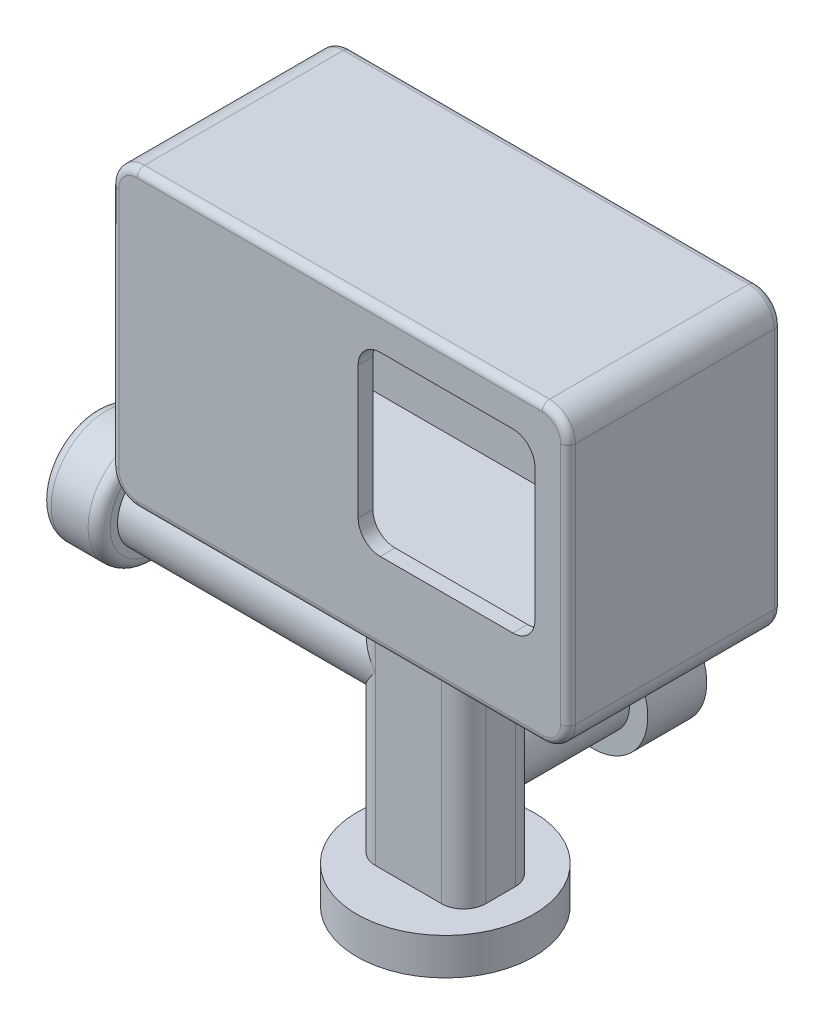
from build123d import *

# Parameters (mm, degrees)
BOSS_EXTRUDE1_DEPTH      = 27
BOSS_EXTRUDE2_START      = 2
BOSS_EXTRUDE2_DEPTH      = 2
SKETCH3_W                = 15
SKETCH3_H                = 10
BOSS_EXTRUDE3_DEPTH      = 40
SKETCH4_R                = 12
BOSS_EXTRUDE4_DEPTH      = 5
FILLET2_R                = 3
BOSS_EXTRUDE5_DEPTH      = 32
BOSS_EXTRUDE5_DEPTH_BACK = 10
SKETCH5_R                = 5
SKETCH6_R                = 7.5
BOSS_EXTRUDE6_DEPTH      = 8
SKETCH7_R                = 5
BOSS_EXTRUDE7_DEPTH      = 5
BOSS_EXTRUDE8_DEPTH      = 1
FILLET3_R                = 1
FILLET4_R                = 1.5
FILLET5_R                = 1
BOSS_EXTRUDE9_DEPTH      = 15
BOSS_EXTRUDE9_DEPTH_BACK = 5
SKETCH9_R                = 5
SKETCH11_R               = 7.5
BOSS_EXTRUDE10_DEPTH     = 8


with BuildPart() as part:
    # Sketch1 → Boss-Extrude1 (new body)
    with BuildSketch(Plane.XY):
        with BuildLine():
            Line((31, 80), (31, 47))
            ThreePointArc((31, 47), (29.974873734, 44.525126266), (27.5, 43.5))
            Line((27.5, 43.5), (-27.5, 43.5))
            ThreePointArc((-27.5, 43.5), (-29.974873734, 44.525126266), (-31, 47))
            Line((-31, 47), (-31, 80))
            ThreePointArc((-31, 80), (-29.974873734, 82.474873734), (-27.5, 83.5))
            Line((-27.5, 83.5), (27.5, 83.5))
            ThreePointArc((27.5, 83.5), (29.974873734, 82.474873734), (31, 80))
        make_face()
        with BuildLine():
            Line((29.5, 80), (29.5, 47))
            ThreePointArc((29.5, 47), (28.914213562, 45.585786438), (27.5, 45))
            Line((27.5, 45), (-27.5, 45))
            ThreePointArc((-27.5, 45), (-28.914213562, 45.585786438), (-29.5, 47))
            Line((-29.5, 47), (-29.5, 80))
            ThreePointArc((-29.5, 80), (-28.914213562, 81.414213562), (-27.5, 82))
            Line((-27.5, 82), (27.5, 82))
            ThreePointArc((27.5, 82), (28.914213562, 81.414213562), (29.5, 80))
        make_face(mode=Mode.SUBTRACT)
    extrude(amount=-BOSS_EXTRUDE1_DEPTH)

    # Sketch2 → Boss-Extrude2 (add)
    with BuildSketch(Plane.XY.offset(BOSS_EXTRUDE2_START)):
        with BuildLine():
            Line((27.5, 83.5), (-27.5, 83.5))
            ThreePointArc((-27.5, 83.5), (-29.974873734, 82.474873734), (-31, 80))
            Line((-31, 80), (-31, 47))
            ThreePointArc((-31, 47), (-29.974873734, 44.525126266), (-27.5, 43.5))
            Line((-27.5, 43.5), (27.5, 43.5))
            ThreePointArc((27.5, 43.5), (29.974873734, 44.525126266), (31, 47))
            Line((31, 47), (31, 80))
            ThreePointArc((31, 80), (29.974873734, 82.474873734), (27.5, 83.5))
        make_face()
        with BuildLine():
            Line((23.5, 78.5), (5.5, 78.5))
            ThreePointArc((5.5, 78.5), (3.378679656, 77.621320344), (2.5, 75.5))
            Line((2.5, 75.5), (2.5, 57.5))
            ThreePointArc((2.5, 57.5), (3.378679656, 55.378679656), (5.5, 54.5))
            Line((5.5, 54.5), (23.5, 54.5))
            ThreePointArc((23.5, 54.5), (25.621320344, 55.378679656), (26.5, 57.5))
            Line((26.5, 57.5), (26.5, 75.5))
            ThreePointArc((26.5, 75.5), (25.621320344, 77.621320344), (23.5, 78.5))
        make_face(mode=Mode.SUBTRACT)
    extrude(amount=-BOSS_EXTRUDE2_DEPTH)

    # Sketch3 → Boss-Extrude3 (add)
    with BuildSketch(Plane.XZ.offset(-43.5)):
        with Locations((0, -12.332332162)):
            Rectangle(SKETCH3_W, SKETCH3_H)
    extrude(amount=BOSS_EXTRUDE3_DEPTH)

    # Sketch4 → Boss-Extrude4 (add)
    with BuildSketch(Plane.XZ.offset(-3.5)):
        with Locations((0, -12.332332162)):
            Circle(SKETCH4_R)
    extrude(amount=-BOSS_EXTRUDE4_DEPTH)

    # Fillet2
    fillet2_edges = [part.edges().sort_by_distance(p)[0] for p in [
        (7.5, 26, -7.332332162),
        (-7.5, 26, -7.332332162),
        (-7.5, 26, -17.332332162),
        (7.5, 26, -17.332332162),
    ]]
    fillet(fillet2_edges, radius=FILLET2_R)

    # Sketch5 → Boss-Extrude5 (add, two sides: drawn at the far end of the back side and taken through both)
    with BuildSketch(Plane.ZY.offset(7.5).offset(-BOSS_EXTRUDE5_DEPTH_BACK)):
        with Locations((-12.332332162, 31.227787974)):
            Circle(SKETCH5_R)
    extrude(amount=BOSS_EXTRUDE5_DEPTH + BOSS_EXTRUDE5_DEPTH_BACK)

    # Sketch6 → Boss-Extrude6 (add)
    with BuildSketch(Plane.ZY.offset(39.5)):
        with Locations((-12.332332162, 31.227787974)):
            Circle(SKETCH6_R)
    extrude(amount=BOSS_EXTRUDE6_DEPTH)

    # Sketch7 → Boss-Extrude7 (add)
    with BuildSketch(Plane.ZY.offset(31)):
        with Locations((-12.5, 71.5)):
            Circle(SKETCH7_R)
        with Locations((-12.5, 56.5)):
            Circle(SKETCH7_R)
    extrude(amount=BOSS_EXTRUDE7_DEPTH)

    # Fillet3
    fillet3_edges = [part.edges().sort_by_distance(p)[0] for p in [
        (29.974873734, 82.474873734, 2),
        (31, 63.5, 2),
        (29.974873734, 44.525126266, 2),
        (0, 43.5, 2),
        (-29.974873734, 44.525126266, 2),
        (-31, 63.5, 2),
        (-29.974873734, 82.474873734, 2),
        (0, 83.5, 2),
        (31, 63.5, -27),
        (29.974873734, 44.525126266, -27),
        (0, 43.5, -27),
        (-29.974873734, 44.525126266, -27),
        (-31, 63.5, -27),
        (-29.974873734, 82.474873734, -27),
        (0, 83.5, -27),
        (29.974873734, 82.474873734, -27),
    ]]
    fillet(fillet3_edges, radius=FILLET3_R)

    # Fillet4
    fillet4_edges = [part.edges().sort_by_distance(p)[0] for p in [
        (-39.5, 31.227787974, -19.832332162),
        (-47.5, 31.227787974, -19.832332162),
    ]]
    fillet(fillet4_edges, radius=FILLET4_R)

    # Fillet5
    fillet5_edges = [part.edges().sort_by_distance(p)[0] for p in [
        (-36, 56.5, -17.5),
        (-36, 71.5, -17.5),
    ]]
    fillet(fillet5_edges, radius=FILLET5_R)

    # Sketch9 → Boss-Extrude9 (add, two sides: drawn at the far end of the back side and taken through both)
    with BuildSketch(Plane(origin=(0, 0, -17.332332162), x_dir=(-1, 0, 0), z_dir=(0, 0, -1)).offset(-BOSS_EXTRUDE9_DEPTH_BACK)):
        with Locations((0, 19.5)):
            Circle(SKETCH9_R)
    extrude(amount=BOSS_EXTRUDE9_DEPTH + BOSS_EXTRUDE9_DEPTH_BACK)

    # Sketch11 → Boss-Extrude10 (add)
    with BuildSketch(Plane(origin=(0, 0, -32.332332162), x_dir=(-1, 0, 0), z_dir=(0, 0, -1))):
        with Locations((0, 19.5)):
            Circle(SKETCH11_R)
    extrude(amount=BOSS_EXTRUDE10_DEPTH)


with BuildPart() as body_2:
    # Sketch8 → Boss-Extrude8 (new body)
    with BuildSketch(Plane(origin=(0, 0, -27), x_dir=(-1, 0, 0), z_dir=(0, 0, -1))):
        with BuildLine():
            Line((-29, 80), (-29, 47))
            ThreePointArc((-29, 47), (-28.560660172, 45.939339828), (-27.5, 45.5))
            Line((-27.5, 45.5), (27.5, 45.5))
            ThreePointArc((27.5, 45.5), (28.560660172, 45.939339828), (29, 47))
            Line((29, 47), (29, 80))
            ThreePointArc((29, 80), (28.560660172, 81.060660172), (27.5, 81.5))
            Line((27.5, 81.5), (-27.5, 81.5))
            ThreePointArc((-27.5, 81.5), (-28.560660172, 81.060660172), (-29, 80))
        make_face()
    extrude(amount=-BOSS_EXTRUDE8_DEPTH)


solid = Compound([part.part, body_2.part])
